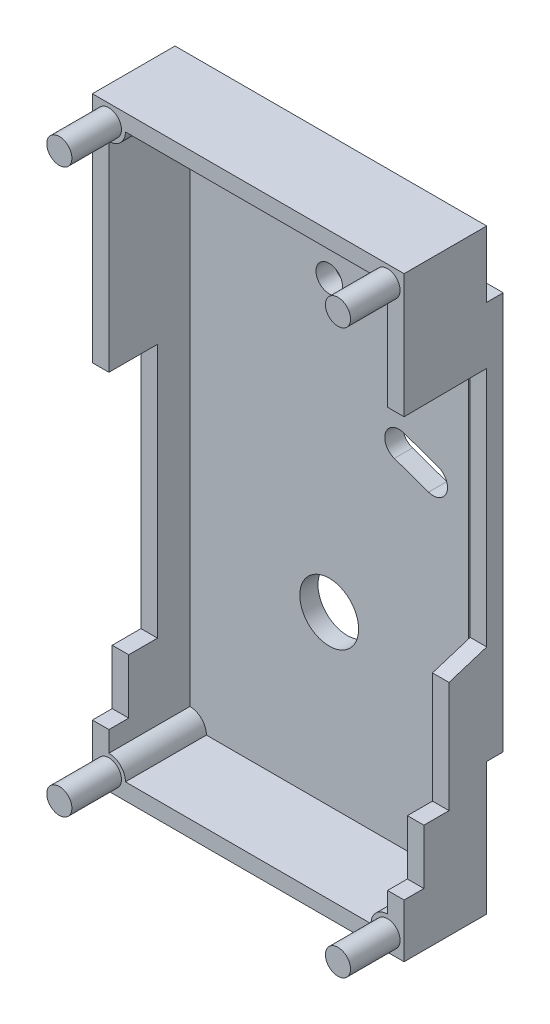
from build123d import *

# Parameters (mm, degrees)
SKETCH2_W                  = 23.9522
SKETCH2_H                  = 45.7962
SKETCH2_R                  = 2.2606
SKETCH2_R_2                = 1.016
BOSS_EXTRUDE1_DEPTH        = 6.35
SKETCH4_W                  = 21.4122
SKETCH4_H                  = 43.2562
CUT_EXTRUDE1_DEPTH         = 6.223
CUT_EXTRUDE3_DEPTH         = 2.54
CUT_EXTRUDE5_DEPTH         = 1.27
BOSS_EXTRUDE3_DEPTH        = 6.223
SKETCH12_R                 = 0.9652
BOSS_EXTRUDE13_DEPTH       = 3.81
BOSS_EXTRUDE15_OUTLINE_W   = 23.9522
BOSS_EXTRUDE15_OUTLINE_H   = 30.5562
BOSS_EXTRUDE15_OUTLINE_R   = 2.2606
BOSS_EXTRUDE15_OUTLINE_R_2 = 1.016
BOSS_EXTRUDE15_DEPTH       = 1.27


# Read off the part's stored shape, not the designer's step: Boss-Extrude15
with BuildPart() as part:
    # Sketch2 → Boss-Extrude1 (new body)
    with BuildSketch(Plane.XY):
        Rectangle(SKETCH2_W, SKETCH2_H)
        with Locations((0, -8.7249)):
            Circle(SKETCH2_R, mode=Mode.SUBTRACT)
        with Locations((0, 13.4747)):
            Circle(SKETCH2_R_2, mode=Mode.SUBTRACT)
        with BuildLine():
            Line((8.361518313, 5.139100055), (5.725634689, 6.065681687))
            ThreePointArc((5.725634689, 6.065681687), (4.333034634, 5.3975), (5.001216321, 4.004899945))
            Line((5.001216321, 4.004899945), (7.637099945, 3.078318313))
            ThreePointArc((7.637099945, 3.078318313), (9.0297, 3.7465), (8.361518313, 5.139100055))
        make_face(mode=Mode.SUBTRACT)
    extrude(amount=BOSS_EXTRUDE1_DEPTH)

    # Sketch4 → Cut-Extrude1 (cut)
    with BuildSketch(Plane.XY.offset(6.35)):
        Rectangle(SKETCH4_W, SKETCH4_H)
    extrude(amount=-CUT_EXTRUDE1_DEPTH, mode=Mode.SUBTRACT)

    # Sketch6 → Cut-Extrude3 (cut)
    with BuildSketch(Plane.ZY.offset(11.9761)):
        Polygon((4.826, -14.5669), (2.6162, -14.5669), (2.6162, 4.9911), (6.35, 4.9911), (6.35, -18.7833), (4.826, -18.7833), align=None)
    extrude(amount=-CUT_EXTRUDE3_DEPTH, mode=Mode.SUBTRACT)

    # Sketch8 → Cut-Extrude5 (cut)
    with BuildSketch(Plane(origin=(11.9761, 0, 0), x_dir=(0, 0, -1), z_dir=(1, 0, 0))):
        Polygon((-6.35, -18.7833), (-4.826, -18.7833), (-4.826, -14.5669), (-2.8956, -14.5669), (-2.8956, -6.0325), (0, -5.1181), (0, 13.4239), (-6.35, 13.3731), align=None)
    extrude(amount=-CUT_EXTRUDE5_DEPTH, mode=Mode.SUBTRACT)

    # Sketch10 → Boss-Extrude3 (add)
    with BuildSketch(Plane.XY.offset(0.127)):
        with BuildLine():
            ThreePointArc((-10.7061, 20.3581), (-9.808074388, 20.730074388), (-9.4361, 21.6281))
            Line((-9.4361, 21.6281), (-10.7061, 21.6281))
            Line((-10.7061, 21.6281), (-10.7061, 20.3581))
        make_face()
        with BuildLine():
            ThreePointArc((9.4361, 21.6281), (9.808074388, 20.730074388), (10.7061, 20.3581))
            Line((10.7061, 20.3581), (10.7061, 21.6281))
            Line((10.7061, 21.6281), (9.4361, 21.6281))
        make_face()
        with BuildLine():
            ThreePointArc((-9.4361, -21.6281), (-9.808074388, -20.730074388), (-10.7061, -20.3581))
            Line((-10.7061, -20.3581), (-10.7061, -21.6281))
            Line((-10.7061, -21.6281), (-9.4361, -21.6281))
        make_face()
        with BuildLine():
            Line((10.7061, -21.6281), (10.7061, -20.3581))
            ThreePointArc((10.7061, -20.3581), (9.808074388, -20.730074388), (9.4361, -21.6281))
            Line((9.4361, -21.6281), (10.7061, -21.6281))
        make_face()
    extrude(amount=BOSS_EXTRUDE3_DEPTH)

    # Sketch12 → Boss-Extrude13 (add)
    with BuildSketch(Plane.XY.offset(6.35)):
        with Locations(Location((-10.7061, 21.6281, 0), (0, 0, 180))):
            Circle(SKETCH12_R)
        with Locations(Location((10.7061, 21.6281, 0), (0, 0, 180))):
            Circle(SKETCH12_R)
        with Locations(Location((10.7061, -21.6281, 0), (0, 0, 180))):
            Circle(SKETCH12_R)
        with Locations(Location((-10.7061, -21.6281, 0), (0, 0, 180))):
            Circle(SKETCH12_R)
    extrude(amount=BOSS_EXTRUDE13_DEPTH)

    # Boss-Extrude15 outline → Boss-Extrude15 (add)
    with BuildSketch(Plane(origin=(0, 0, 0), x_dir=(-1, 0, 0), z_dir=(0, 0, -1))):
        with Locations((0, 2.54)):
            Rectangle(BOSS_EXTRUDE15_OUTLINE_W, BOSS_EXTRUDE15_OUTLINE_H)
        with Locations((0, -8.7249)):
            Circle(BOSS_EXTRUDE15_OUTLINE_R, mode=Mode.SUBTRACT)
        with BuildLine():
            ThreePointArc((-7.637099945, 3.078318313), (-9.0297, 3.7465), (-8.361518313, 5.139100055))
            Line((-8.361518313, 5.139100055), (-5.725634689, 6.065681687))
            ThreePointArc((-5.725634689, 6.065681687), (-4.333034634, 5.3975), (-5.001216321, 4.004899945))
            Line((-5.001216321, 4.004899945), (-7.637099945, 3.078318313))
        make_face(mode=Mode.SUBTRACT)
        with Locations((0, 13.4747)):
            Circle(BOSS_EXTRUDE15_OUTLINE_R_2, mode=Mode.SUBTRACT)
    extrude(amount=BOSS_EXTRUDE15_DEPTH)


solid = part.part
